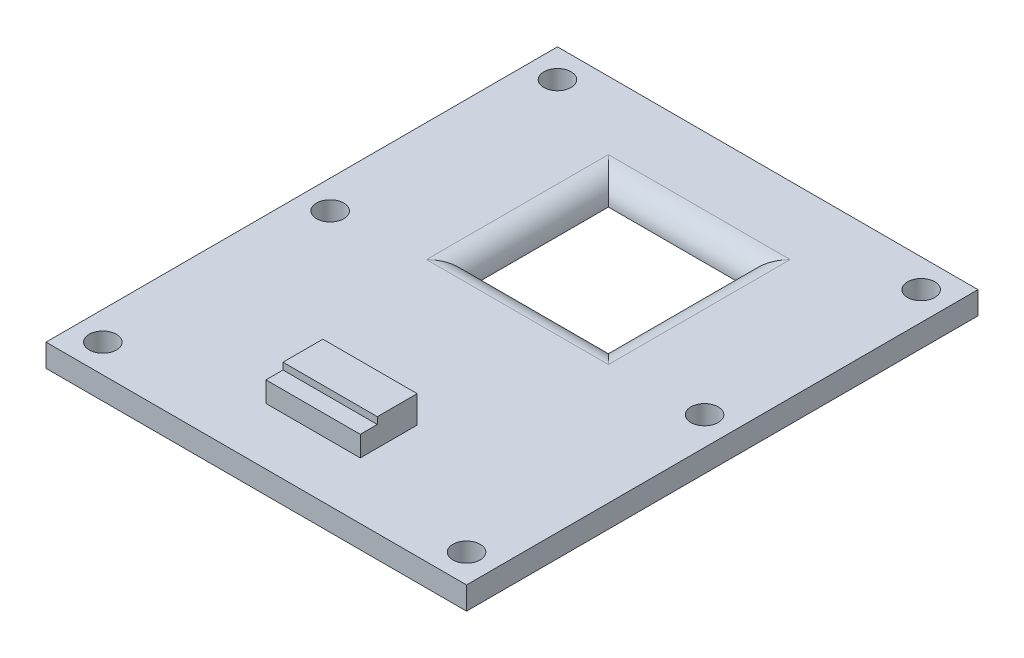
from build123d import *

# Parameters (mm, degrees)
SKETCH1_W            = 27
SKETCH1_H            = 35
SKETCH1_R            = 1.113712744
SKETCH1_R_2          = 1.000106258
SKETCH1_R_3          = 1.174626552
SKETCH1_R_4          = 1.19920455
SKETCH1_W_2          = 8.3
SKETCH1_H_2          = 2.12
BOSS_EXTRUDE1_DEPTH  = 2
CUT_EXTRUDE2_REACH   = 25.536
SKETCH10_W           = 12
SKETCH10_H           = 12
FILLET1_R            = 2
SKETCH12_W           = 8.3
SKETCH12_H           = 1.5
BOSS_EXTRUDE5_DEPTH  = 1.8
SKETCH13_W           = 8.3
SKETCH13_H           = 3.507295064
BOSS_EXTRUDE6_DEPTH  = 2.395619389
SKETCH14_W           = 37
SKETCH14_H           = 45
SKETCH14_W_2         = 27
SKETCH14_H_2         = 35
BOSS_EXTRUDE7_DEPTH  = 2
M2_CLEARANCE_HOLE3_D = 2.4


with BuildPart() as part:
    # Sketch1 → Boss-Extrude1 (new body)
    # profile 1 of 8: a face of its own
    with BuildSketch(Plane(origin=(0, 0, 0), x_dir=(1, 0, 0), z_dir=(0, 1, 0))):
        with Locations((0.988085162, -0.939800033)):
            Rectangle(SKETCH1_W, SKETCH1_H)
        Polygon((-10.011914838, -15.939800033), (-10.011914838, 14.060199967), (11.988085162, 14.060199967), (11.988085162, -15.939800033), (5.138085162, -15.939800033), (5.138085162, -18.059800033), (-3.161914838, -18.059800033), (-3.161914838, -15.939800033), align=None, mode=Mode.SUBTRACT)
    # profile 2 of 8: a face of its own
    with BuildSketch(Plane(origin=(0, 0, 0), x_dir=(1, 0, 0), z_dir=(0, 1, 0))):
        Polygon((11.988085162, 14.060199967), (-10.011914838, 14.060199967), (-10.011914838, -15.939800033), (-3.161914838, -15.939800033), (-3.161914838, -13.819800033), (5.138085162, -13.819800033), (5.138085162, -15.939800033), (11.988085162, -15.939800033), align=None)
        with Locations((-8.011914838, -13.939800033)):
            Circle(SKETCH1_R, mode=Mode.SUBTRACT)
        with Locations((9.988085162, -14.291814947)):
            Circle(SKETCH1_R_2, mode=Mode.SUBTRACT)
        with Locations((-8.011914838, 7.560199967)):
            Circle(SKETCH1_R_3, mode=Mode.SUBTRACT)
        with Locations((9.988085162, 7.560199967)):
            Circle(SKETCH1_R_4, mode=Mode.SUBTRACT)
    # profile 3 of 8: a face of its own
    with BuildSketch(Plane(origin=(0, 0, 0), x_dir=(1, 0, 0), z_dir=(0, 1, 0))):
        with Locations((-8.011914838, 7.560199967)):
            Circle(SKETCH1_R_3)
    # profile 4 of 8: a face of its own
    with BuildSketch(Plane(origin=(0, 0, 0), x_dir=(1, 0, 0), z_dir=(0, 1, 0))):
        with Locations((9.988085162, 7.560199967)):
            Circle(SKETCH1_R_4)
    # profile 5 of 8: a face of its own
    with BuildSketch(Plane(origin=(0, 0, 0), x_dir=(1, 0, 0), z_dir=(0, 1, 0))):
        with Locations((9.988085162, -14.291814947)):
            Circle(SKETCH1_R_2)
    # profile 6 of 8: a face of its own
    with BuildSketch(Plane(origin=(0, 0, 0), x_dir=(1, 0, 0), z_dir=(0, 1, 0))):
        with Locations((0.988085162, -16.999800033)):
            Rectangle(SKETCH1_W_2, SKETCH1_H_2)
    # profile 7 of 8: a face of its own
    with BuildSketch(Plane(origin=(0, 0, 0), x_dir=(1, 0, 0), z_dir=(0, 1, 0))):
        with Locations((0.988085162, -14.879800033)):
            Rectangle(SKETCH1_W_2, SKETCH1_H_2)
    # profile 8 of 8: a face of its own
    with BuildSketch(Plane(origin=(0, 0, 0), x_dir=(1, 0, 0), z_dir=(0, 1, 0))):
        with Locations((-8.011914838, -13.939800033)):
            Circle(SKETCH1_R)
    extrude(amount=BOSS_EXTRUDE1_DEPTH)

    # Sketch10 → Cut-Extrude2 (cut, up to next)
    with BuildSketch(Plane(origin=(0, 2, 0), x_dir=(1, 0, 0), z_dir=(0, 1, 0)), mode=Mode.PRIVATE) as cut_extrude2_sk1:
        with Locations((0.938085162, 7.590199967)):
            Rectangle(SKETCH10_W, SKETCH10_H)
    cut_extrude2_tool1 = extrude(cut_extrude2_sk1.sketch, amount=-CUT_EXTRUDE2_REACH, mode=Mode.PRIVATE) & part.part
    add(cut_extrude2_tool1.solids().sort_by_distance((0.938085, 2, -7.5902))[0], mode=Mode.SUBTRACT)

    # Fillet1
    fillet1_edges = [part.edges().sort_by_distance(p)[0] for p in [
        (0.938085162, 2, -13.590199967),
        (6.938085162, 2, -7.590199967),
        (0.938085162, 2, -1.590199967),
        (-5.061914838, 2, -7.590199967),
    ]]
    fillet(fillet1_edges, radius=FILLET1_R - 0.0001)  # a hair under: the kernel refuses the full size

    # Sketch12 → Boss-Extrude5 (add)
    with BuildSketch(Plane(origin=(0, 2, 0), x_dir=(1, 0, 0), z_dir=(0, 1, 0))):
        with Locations((0.988085162, -17.689800033)):
            Rectangle(SKETCH12_W, SKETCH12_H)
    extrude(amount=BOSS_EXTRUDE5_DEPTH)

    # Sketch13 → Boss-Extrude6 (add)
    with BuildSketch(Plane(origin=(0, 2, 0), x_dir=(1, 0, 0), z_dir=(0, 1, 0))):
        with Locations((0.988085162, -15.186152501)):
            Rectangle(SKETCH13_W, SKETCH13_H)
    extrude(amount=BOSS_EXTRUDE6_DEPTH)

    # Sketch14 → Boss-Extrude7 (add)
    with BuildSketch(Plane.XZ):
        with Locations((0.988085162, 0.939800033)):
            Rectangle(SKETCH14_W, SKETCH14_H)
        with Locations((0.988085162, 0.939800033)):
            Rectangle(SKETCH14_W_2, SKETCH14_H_2, mode=Mode.SUBTRACT)
    extrude(amount=-BOSS_EXTRUDE7_DEPTH)

    # M2 Clearance Hole3 (through all)
    with Locations(Plane(origin=(0, 0, 0), x_dir=(-1, 0, 0), z_dir=(0, -1, 0))):
        with Locations((-16.988085162, 19.060199967), (15.011914838, 19.060199967), (15.011914838, -0.939800033), (15.011914838, -20.939800033), (-16.988085162, -20.939800033), (-16.988085162, -1.8e-07)):
            Hole(M2_CLEARANCE_HOLE3_D / 2)


solid = part.part
